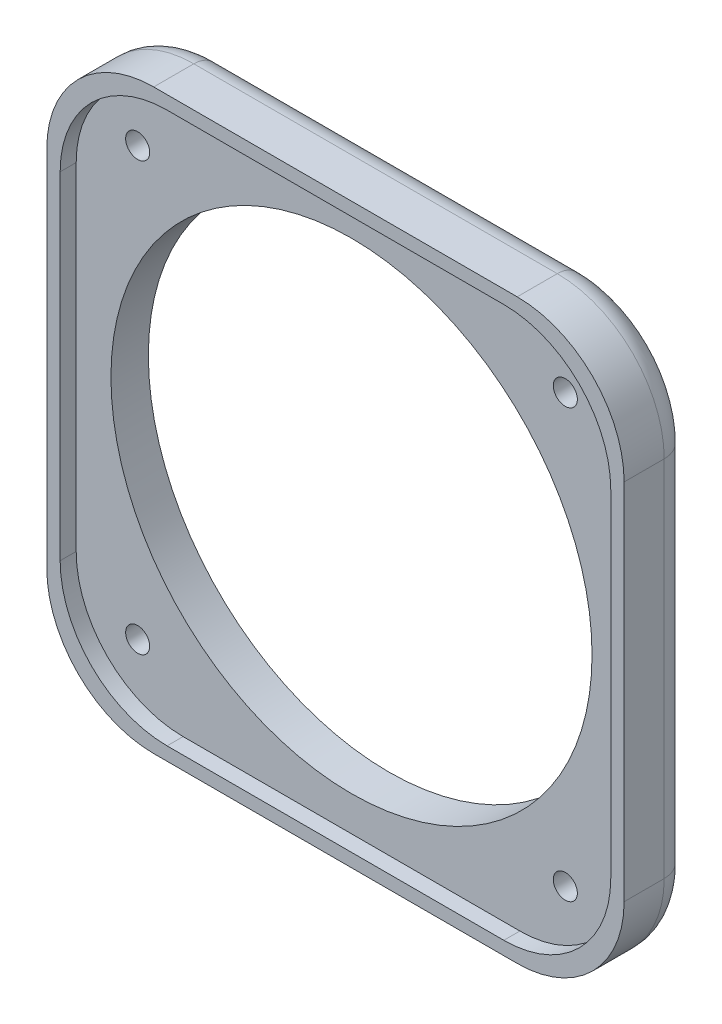
from build123d import *

# Parameters (mm, degrees)
ESQUISSE1_R        = 45
ESQUISSE1_R_2      = 2.25
BOSS_EXTRU_1_DEPTH = 7
BOSS_EXTRU_2_DEPTH = 3
BOSS_EXTRU_3_START = 2.5
BOSS_EXTRU_3_DEPTH = 2.5
CONG_1_R           = 5


with BuildPart() as part:
    # Esquisse1 → Boss.-Extru.1 (new body)
    with BuildSketch(Plane.XY):
        with BuildLine():
            Line((20, 0), (88, 0))
            ThreePointArc((88, 0), (102.142135624, -5.857864376), (108, -20))
            Line((108, -20), (108, -88))
            ThreePointArc((108, -88), (102.142135624, -102.142135624), (88, -108))
            Line((88, -108), (20, -108))
            ThreePointArc((20, -108), (5.857864376, -102.142135624), (0, -88))
            Line((0, -88), (0, -20))
            ThreePointArc((0, -20), (5.857864376, -5.857864376), (20, 0))
        make_face()
        with Locations((54, -54)):
            Circle(ESQUISSE1_R, mode=Mode.SUBTRACT)
        with Locations((14, -14)):
            Circle(ESQUISSE1_R_2, mode=Mode.SUBTRACT)
        with Locations((94, -14)):
            Circle(ESQUISSE1_R_2, mode=Mode.SUBTRACT)
        with Locations((94, -94)):
            Circle(ESQUISSE1_R_2, mode=Mode.SUBTRACT)
        with Locations((14, -94)):
            Circle(ESQUISSE1_R_2, mode=Mode.SUBTRACT)
    extrude(amount=BOSS_EXTRU_1_DEPTH)

    # Esquisse2 → Boss.-Extru.2 (add)
    with BuildSketch(Plane.XY.offset(7)):
        with BuildLine():
            Line((20, 0), (88, 0))
            ThreePointArc((88, 0), (102.142135624, -5.857864376), (108, -20))
            Line((108, -20), (108, -88))
            ThreePointArc((108, -88), (102.142135624, -102.142135624), (88, -108))
            Line((88, -108), (20, -108))
            ThreePointArc((20, -108), (5.857864376, -102.142135624), (0, -88))
            Line((0, -88), (0, -20))
            ThreePointArc((0, -20), (5.857864376, -5.857864376), (20, 0))
        make_face()
        with BuildLine():
            Line((22.5, -2.5), (85.5, -2.5))
            ThreePointArc((85.5, -2.5), (99.642135624, -8.357864376), (105.5, -22.5))
            Line((105.5, -22.5), (105.5, -85.5))
            ThreePointArc((105.5, -85.5), (99.642135624, -99.642135624), (85.5, -105.5))
            Line((85.5, -105.5), (22.5, -105.5))
            ThreePointArc((22.5, -105.5), (8.357864376, -99.642135624), (2.5, -85.5))
            Line((2.5, -85.5), (2.5, -22.5))
            ThreePointArc((2.5, -22.5), (8.357864376, -8.357864376), (22.5, -2.5))
        make_face(mode=Mode.SUBTRACT)
    extrude(amount=BOSS_EXTRU_2_DEPTH)

    # Esquisse3 → Boss.-Extru.3 (add)
    with BuildSketch(Plane(origin=(0, 0, 0), x_dir=(-1, 0, 0), z_dir=(0, 0, -1)).offset(BOSS_EXTRU_3_START)):
        with BuildLine():
            Line((-20, 0), (-88, 0))
            ThreePointArc((-88, 0), (-102.142135624, -5.857864376), (-108, -20))
            Line((-108, -20), (-108, -88))
            ThreePointArc((-108, -88), (-102.142135624, -102.142135624), (-88, -108))
            Line((-88, -108), (-20, -108))
            ThreePointArc((-20, -108), (-5.857864376, -102.142135624), (0, -88))
            Line((0, -88), (0, -20))
            ThreePointArc((0, -20), (-5.857864376, -5.857864376), (-20, 0))
        make_face()
        with BuildLine():
            Line((-84, -104), (-24, -104))
            ThreePointArc((-24, -104), (-9.857864376, -98.142135624), (-4, -84))
            Line((-4, -84), (-4, -24))
            ThreePointArc((-4, -24), (-9.857864376, -9.857864376), (-24, -4))
            Line((-24, -4), (-84, -4))
            ThreePointArc((-84, -4), (-98.142135624, -9.857864376), (-104, -24))
            Line((-104, -24), (-104, -84))
            ThreePointArc((-104, -84), (-98.142135624, -98.142135624), (-84, -104))
        make_face(mode=Mode.SUBTRACT)
    extrude(amount=-BOSS_EXTRU_3_DEPTH)

    # Congé1
    # the kernel refuses this fillet: 5 mm, written as the material it takes off along each edge
    with BuildSketch(Plane(origin=(88, -88, -2.5), x_dir=(1, 0, 0), z_dir=(0, 1, 0))) as cong_1_piece_1:
        with BuildLine():
            CenterArc((20 - CONG_1_R, -CONG_1_R), CONG_1_R, 0, 90)
            Line((20 - CONG_1_R, 0), (20, 0))
            Line((20, 0), (20, -CONG_1_R))
        make_face()
    revolve(axis=Axis((88, -88, -2.5), (0, 0, -1)), revolution_arc=90, mode=Mode.SUBTRACT)
    with BuildSketch(Plane(origin=(88, -20, -2.5), x_dir=(0, 1, 0), z_dir=(-1, 0, 0))) as cong_1_piece_2:
        with BuildLine():
            CenterArc((20 - CONG_1_R, -CONG_1_R), CONG_1_R, 0, 90)
            Line((20 - CONG_1_R, 0), (20, 0))
            Line((20, 0), (20, -CONG_1_R))
        make_face()
    revolve(axis=Axis((88, -20, -2.5), (0, 0, -1)), revolution_arc=90, mode=Mode.SUBTRACT)
    with BuildSketch(Plane(origin=(20, -20, -2.5), x_dir=(-1, 0, 0), z_dir=(0, -1, 0))) as cong_1_piece_3:
        with BuildLine():
            CenterArc((20 - CONG_1_R, -CONG_1_R), CONG_1_R, 0, 90)
            Line((20, -CONG_1_R), (20, 0))
            Line((20, 0), (20 - CONG_1_R, 0))
        make_face()
    revolve(axis=Axis((20, -20, -2.5), (0, 0, -1)), revolution_arc=90, mode=Mode.SUBTRACT)
    with BuildSketch(Plane(origin=(20, -88, -2.5), x_dir=(0, -1, 0), z_dir=(1, 0, 0))) as cong_1_piece_4:
        with BuildLine():
            CenterArc((20 - CONG_1_R, -CONG_1_R), CONG_1_R, 0, 90)
            Line((20 - CONG_1_R, 0), (20, 0))
            Line((20, 0), (20, -CONG_1_R))
        make_face()
    revolve(axis=Axis((20, -88, -2.5), (0, 0, -1)), revolution_arc=90, mode=Mode.SUBTRACT)
    with BuildSketch(Plane(origin=(88, -108, -2.5), x_dir=(0, 0, 1), z_dir=(-1, 0, 0)), Plane(origin=(0, -88, -2.5), x_dir=(0, 0, 1), z_dir=(0, 1, 0)), Plane(origin=(20, 0, -2.5), x_dir=(0, 0, 1), z_dir=(1, 0, 0)), Plane(origin=(108, -20, -2.5), x_dir=(0, 0, 1), z_dir=(0, -1, 0))) as cong_1_piece_5:
        with BuildLine():
            CenterArc((CONG_1_R, CONG_1_R), CONG_1_R, 180, 90)
            Line((0, CONG_1_R), (0, 0))
            Line((0, 0), (CONG_1_R, 0))
        make_face()
    extrude(amount=68, mode=Mode.SUBTRACT)


solid = part.part
